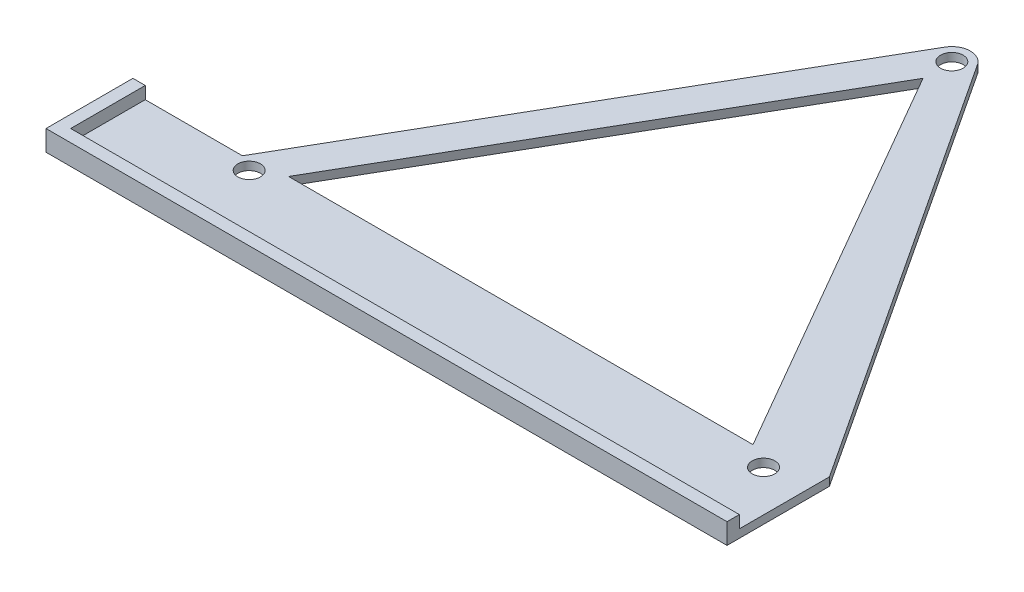
from build123d import *

# Parameters (mm, degrees)
SKETCH1_R           = 2.75
BOSS_EXTRUDE4_DEPTH = 2
BOSS_EXTRUDE7_DEPTH = 5


with BuildPart() as part:
    # Sketch1 → Boss-Extrude4 (new body)
    with BuildSketch(Plane(origin=(0, 0, 0), x_dir=(1, 0, 0), z_dir=(0, 1, 0))):
        with BuildLine():
            ThreePointArc((3.897114317, 56.376587737), (0, 58.626587737), (-3.897114317, 56.376587737))
            Line((-3.897114317, 56.376587737), (-66.397114317, -51.876587737))
            Line((-66.397114317, -51.876587737), (-90, -51.876587737))
            Line((-90, -51.876587737), (-90, -70))
            Line((-90, -70), (72.5, -70))
            Line((72.5, -70), (72.5, -48.115728134))
            Line((72.5, -48.115728134), (3.897114317, 56.376587737))
        make_face()
        with Locations((-62.5, -54.126587737)):
            Circle(SKETCH1_R, mode=Mode.SUBTRACT)
        with Locations((62.5, -54.126587737)):
            Circle(SKETCH1_R, mode=Mode.SUBTRACT)
        Polygon((56.437822174, -50.626587737), (-56.437822174, -50.626587737), (0, 47.126587737), align=None, mode=Mode.SUBTRACT)
        with Locations((0, 54.126587737)):
            Circle(SKETCH1_R, mode=Mode.SUBTRACT)
    extrude(amount=BOSS_EXTRUDE4_DEPTH)

    # Sketch1<6> → Boss-Extrude7 (add)
    with BuildSketch(Plane(origin=(0, 0, 0), x_dir=(1, 0, 0), z_dir=(0, 1, 0))):
        Polygon((-90, -70), (-90, -51.876587737), (-93, -51.876587737), (-93, -73), (72.5, -73), (72.5, -70), align=None)
    extrude(amount=BOSS_EXTRUDE7_DEPTH)


solid = part.part
